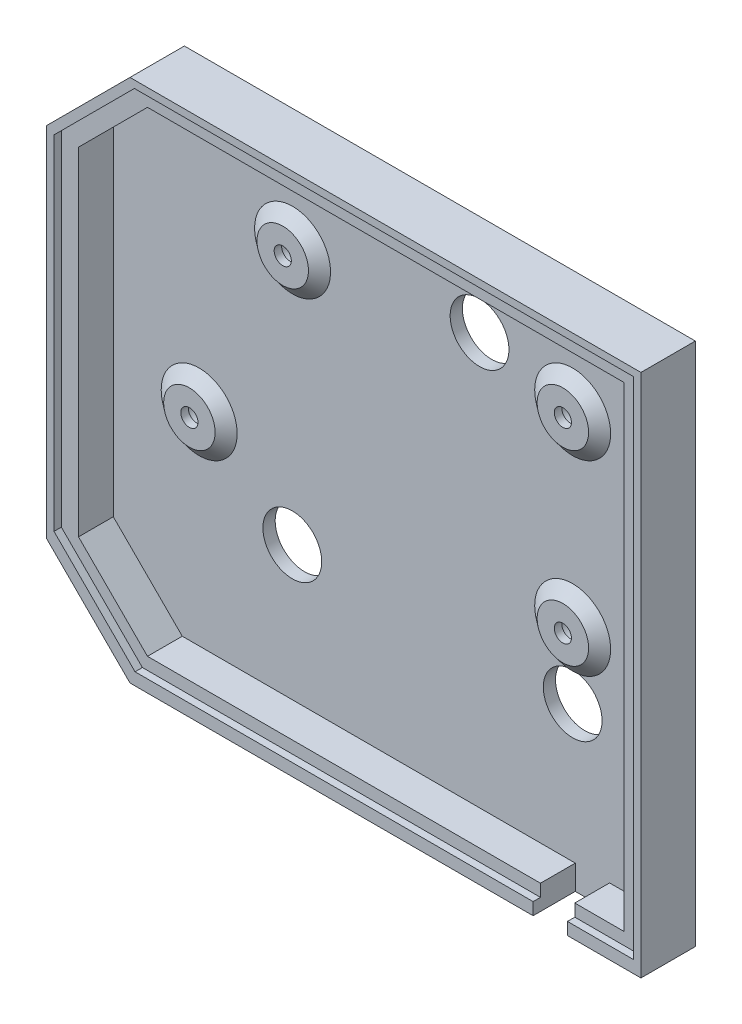
from build123d import *

# Parameters (mm, degrees)
BOSS_EXTRU_1_DEPTH           = 2.5
BOSS_EXTRU_2_DEPTH           = 8.6
ESQUISSE15_W                 = 1.8
ESQUISSE15_H                 = 2.5
D_GAGEMENT_M31_AT_2_COUNT    = 2
D_GAGEMENT_M31_AT_2_PITCH    = 76.2
D_GAGEMENT_M31_AT_3_COUNT    = 2
D_GAGEMENT_M31_AT_3_PITCH    = 38.1
D_GAGEMENT_M31_AT_4_COUNT    = 2
D_GAGEMENT_M31_AT_4_PITCH    = 68.685751798
ESQUISSE16_R                 = 2.7
ENL_V_MAT_EXTRU_2_DEPTH      = 3
ENL_V_MAT_EXTRU_3_DEPTH      = 1.5
ENL_V_MAT_EXTRU_4_DEPTH      = 10
ENL_V_MAT_EXTRU_4_DEPTH_BACK = 10
ESQUISSE20_R                 = 6
CHANFREIN3_SIZE              = 0.577350269
CHANFREIN3_SIZE_2            = 1


with BuildPart() as part:
    # Esquisse1 → Boss.-Extru.1 (new body)
    with BuildSketch(Plane.XY):
        Polygon((0, -85), (17, -102), (121.25, -102), (121.25, 5), (17, 5), (0, -12), align=None)
    extrude(amount=BOSS_EXTRU_1_DEPTH)

    # Esquisse2 → Boss.-Extru.2 (add)
    with BuildSketch(Plane.XY.offset(2.5)):
        Polygon((5, -82.928932188), (19.071067812, -97), (99.25, -97), (99.25, -102), (17, -102), (0, -85), (0, -12), (17, 5), (121.25, 5), (121.25, -102), (106.25, -102), (106.25, -97), (116.25, -97), (116.25, 0), (19.071067812, 0), (5, -14.071067812), align=None)
    extrude(amount=BOSS_EXTRU_2_DEPTH)

    # Esquisse9 → Révolution1 (revolve)
    with BuildSketch(Plane(origin=(0, -55.63, 0), x_dir=(-1, 0, 0), z_dir=(0, -1, 0))):
        Polygon((-96.97, -2.5), (-90.97, -2.5), (-93.47, -4.5), (-96.97, -4.5), align=None)
    revolve(axis=Axis((98.72, -55.63, 2.5), (0, 0, 1)))

    # Esquisse11 → Révolution2 (revolve)
    with BuildSketch(Plane(origin=(0, -55.63, 0), x_dir=(-1, 0, 0), z_dir=(0, -1, 0)), mode=Mode.PRIVATE) as r_volution2_sk:
        Polygon((-24.27, -2.5), (-30.27, -2.5), (-27.77, -4.5), (-24.27, -4.5), align=None)
    revolve(r_volution2_sk.sketch.rotate(Axis((22.52, -55.63, 2.5), (0, 0, 1)), 180), axis=Axis((22.52, -55.63, 2.5), (0, 0, 1)))

    # Esquisse12 → Révolution3 (revolve)
    with BuildSketch(Plane(origin=(0, -17.53, 0), x_dir=(1, 0, 0), z_dir=(0, 1, 0))):
        Polygon((96.97, -2.5), (90.97, -2.5), (93.47, -4.5), (96.97, -4.5), align=None)
    revolve(axis=Axis((98.72, -17.53, 2.5), (0, 0, 1)))

    # Esquisse13 → Révolution4 (revolve)
    with BuildSketch(Plane(origin=(0, -17.53, 0), x_dir=(1, 0, 0), z_dir=(0, 1, 0)), mode=Mode.PRIVATE) as r_volution4_sk:
        Polygon((43.32, -2.5), (49.32, -2.5), (46.82, -4.5), (43.32, -4.5), align=None)
    revolve(r_volution4_sk.sketch.rotate(Axis((41.57, -17.53, 2.5), (0, 0, 1)), 180), axis=Axis((41.57, -17.53, 2.5), (0, 0, 1)))

    # Esquisse15 → Dégagement M31 (revolve, cut)
    with BuildSketch(Plane(origin=(98.72, -55.63, 2.5), x_dir=(0, -1, 0), z_dir=(1, 0, 0))):
        with Locations((0.9, 1.25)):
            Rectangle(ESQUISSE15_W, ESQUISSE15_H)
    d_gagement_m31 = revolve(axis=Axis((98.72, -55.63, 8.85), (0, 0, -1)), mode=Mode.SUBTRACT)

    # Dégagement M31 at 2: Dégagement M31 ×2
    with Locations(*[(-i * D_GAGEMENT_M31_AT_2_PITCH, 0, 0) for i in range(1, D_GAGEMENT_M31_AT_2_COUNT)]):
        add(d_gagement_m31, mode=Mode.SUBTRACT)

    # Dégagement M31 at 3: Dégagement M31 ×2
    with Locations(*[(0, i * D_GAGEMENT_M31_AT_3_PITCH, 0) for i in range(1, D_GAGEMENT_M31_AT_3_COUNT)]):
        add(d_gagement_m31, mode=Mode.SUBTRACT)

    # Dégagement M31 at 4: Dégagement M31 ×2
    with Locations(*[Vector(-0.8320502943378437, 0.5547001962252291, 0) * (i * D_GAGEMENT_M31_AT_4_PITCH) for i in range(1, D_GAGEMENT_M31_AT_4_COUNT)]):
        add(d_gagement_m31, mode=Mode.SUBTRACT)

    # Esquisse16 → Enlèv. mat.-Extru.2 (cut)
    with BuildSketch(Plane(origin=(0, 0, 0), x_dir=(-1, 0, 0), z_dir=(0, 0, -1))):
        with Locations((-22.52, -55.63)):
            Circle(ESQUISSE16_R)
        with Locations((-98.72, -55.63)):
            Circle(ESQUISSE16_R)
        with Locations((-98.72, -17.53)):
            Circle(ESQUISSE16_R)
        with Locations((-41.57, -17.53)):
            Circle(ESQUISSE16_R)
    extrude(amount=-ENL_V_MAT_EXTRU_2_DEPTH, mode=Mode.SUBTRACT)

    # Esquisse17 → Enlèv. mat.-Extru.3 (cut)
    with BuildSketch(Plane.XY.offset(11.1)):
        Polygon((119.75, -99.5), (119.75, 3.5), (17.904163056, 3.5), (1.5, -12.904163056), (1.5, -82.964466094), (18.035533906, -99.5), align=None)
    extrude(amount=-ENL_V_MAT_EXTRU_3_DEPTH, mode=Mode.SUBTRACT)

    # Esquisse20 → Enlèv. mat.-Extru.4 (cut, two sides: drawn at the far end of the back side and taken through both)
    with BuildSketch(Plane.XY.offset(2.5).offset(-ENL_V_MAT_EXTRU_4_DEPTH_BACK)):
        with Locations(Location((98.72, -69.13, 0), (0, 0, 180))):
            Circle(ESQUISSE20_R)
        with Locations(Location((41.52, -69.63, 0), (0, 0, 180))):
            Circle(ESQUISSE20_R)
        with Locations(Location((79.72, -13.03, 0), (0, 0, 180))):
            Circle(ESQUISSE20_R)
    extrude(amount=ENL_V_MAT_EXTRU_4_DEPTH + ENL_V_MAT_EXTRU_4_DEPTH_BACK, mode=Mode.SUBTRACT)

    # Chanfrein3
    # the kernel refuses this chamfer: 1, 0.577350269 mm, written as the material it adds along each edge
    with BuildSketch(Plane(origin=(41.57, -17.53, 3), x_dir=(-1, 0, 0), z_dir=(0, -1, 0))) as chanfrein3_piece_1_section:
        Polygon((2.7, CHANFREIN3_SIZE), (2.7 - CHANFREIN3_SIZE_2, 0), (2.7, 0), align=None)
    chanfrein3_piece_1 = revolve(axis=Axis((41.57, -17.53, 3), (0, 0, -1)), mode=Mode.PRIVATE)
    chanfrein3_piece_1 = chanfrein3_piece_1 - Plane(origin=(41.57, -17.53, 2.701530762), x_dir=(-1, 0, 0), z_dir=(0, 0, -1)) * Cylinder(1.75, 11, mode=Mode.PRIVATE)
    add(chanfrein3_piece_1)
    with BuildSketch(Plane(origin=(98.72, -17.53, 3), x_dir=(-1, 0, 0), z_dir=(0, -1, 0))) as chanfrein3_piece_2_section:
        Polygon((2.7, CHANFREIN3_SIZE), (2.7 - CHANFREIN3_SIZE_2, 0), (2.7, 0), align=None)
    chanfrein3_piece_2 = revolve(axis=Axis((98.72, -17.53, 3), (0, 0, -1)), mode=Mode.PRIVATE)
    chanfrein3_piece_2 = chanfrein3_piece_2 - Plane(origin=(98.72, -17.53, 2.701530762), x_dir=(-1, 0, 0), z_dir=(0, 0, -1)) * Cylinder(1.75, 11, mode=Mode.PRIVATE)
    add(chanfrein3_piece_2)
    with BuildSketch(Plane(origin=(98.72, -55.63, 3), x_dir=(-1, 0, 0), z_dir=(0, -1, 0))) as chanfrein3_piece_3_section:
        Polygon((2.7, CHANFREIN3_SIZE), (2.7 - CHANFREIN3_SIZE_2, 0), (2.7, 0), align=None)
    chanfrein3_piece_3 = revolve(axis=Axis((98.72, -55.63, 3), (0, 0, -1)), mode=Mode.PRIVATE)
    chanfrein3_piece_3 = chanfrein3_piece_3 - Plane(origin=(98.72, -55.63, 2.701530762), x_dir=(-1, 0, 0), z_dir=(0, 0, -1)) * Cylinder(1.75, 11, mode=Mode.PRIVATE)
    add(chanfrein3_piece_3)
    with BuildSketch(Plane(origin=(22.52, -55.63, 3), x_dir=(-1, 0, 0), z_dir=(0, -1, 0))) as chanfrein3_piece_4_section:
        Polygon((2.7, CHANFREIN3_SIZE), (2.7 - CHANFREIN3_SIZE_2, 0), (2.7, 0), align=None)
    chanfrein3_piece_4 = revolve(axis=Axis((22.52, -55.63, 3), (0, 0, -1)), mode=Mode.PRIVATE)
    chanfrein3_piece_4 = chanfrein3_piece_4 - Plane(origin=(22.52, -55.63, 2.701530762), x_dir=(-1, 0, 0), z_dir=(0, 0, -1)) * Cylinder(1.75, 11, mode=Mode.PRIVATE)
    add(chanfrein3_piece_4)


solid = part.part
